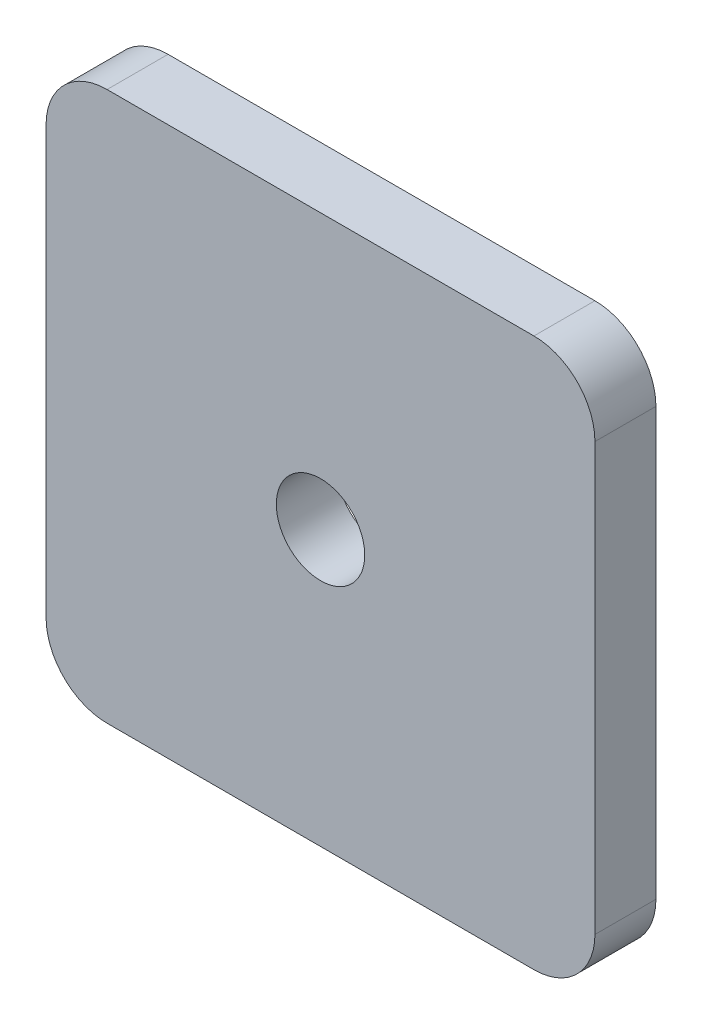
from build123d import *

# Parameters (mm, degrees)
IZIM1_W            = 90
IZIM1_H            = 90
IZIM1_R            = 7.25
TABAN_FLAN_1_DEPTH = 10
RADYUS1_R          = 10


# Sheet-metal steps are written as plain solids
with BuildPart() as part:
    # Çizim1 → Taban-Flanş1 (new body)
    with BuildSketch(Plane.XY):
        Rectangle(IZIM1_W, IZIM1_H)
        Circle(IZIM1_R, mode=Mode.SUBTRACT)
    extrude(amount=-TABAN_FLAN_1_DEPTH)

    # Radyus1
    radyus1_edges = [part.edges().sort_by_distance(p)[0] for p in [
        (45, -45, -5),
        (-45, -45, -5),
        (-45, 45, -5),
        (45, 45, -5),
    ]]
    fillet(radyus1_edges, radius=RADYUS1_R)


solid = part.part
